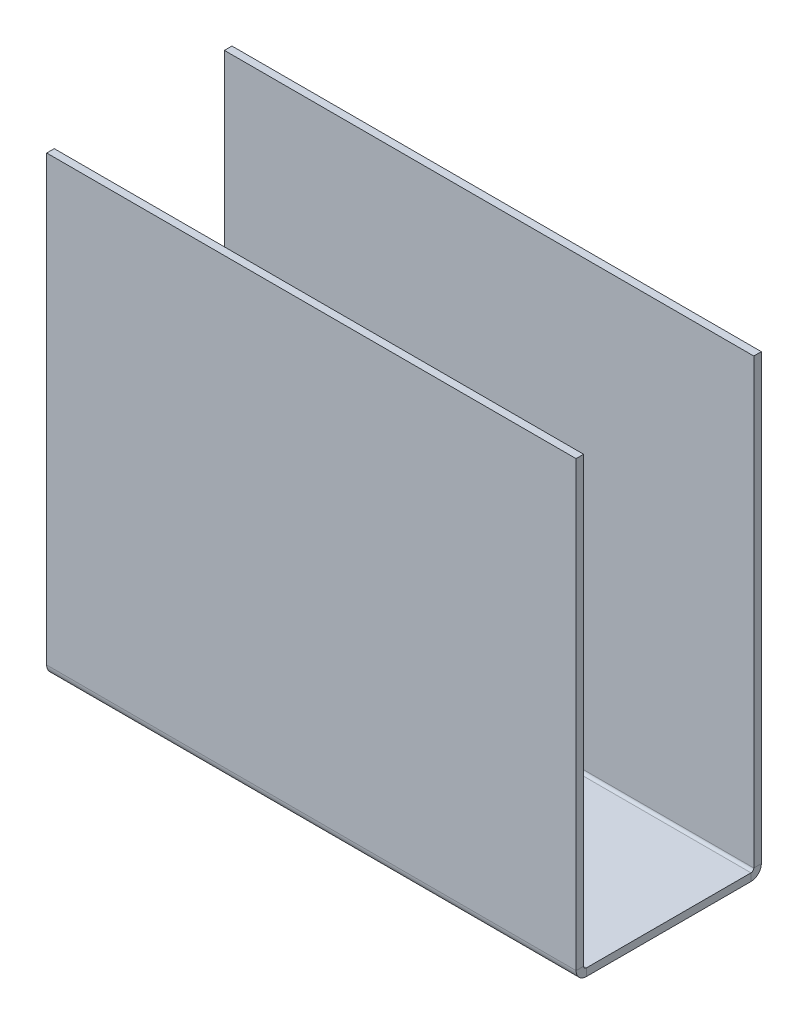
from build123d import *

# Parameters (mm, degrees)
SKETCH1_W                      = 140
SKETCH1_H                      = 49
BASE_FLANGE1_DEPTH             = 2
EDGE_FLANGE1_STRIP_W           = 9.4732
EDGE_FLANGE1_STRIP_H           = 2
EDGE_FLANGE1_STRIP_CUT_DEPTH   = 140
EDGE_FLANGE1_STRIP_2_W         = 9.4732
EDGE_FLANGE1_STRIP_2_H         = 2
EDGE_FLANGE1_STRIP_CUT_2_DEPTH = 140
EDGE_FLANGE1_DEPTH             = 140
EDGE_FLANGE1_BEND_DEPTH        = 140


# Sheet-metal steps are written as plain solids
with BuildPart() as part:
    # Sketch1 → Base-Flange1 (new body)
    with BuildSketch(Plane(origin=(0, 0, 0), x_dir=(1, 0, 0), z_dir=(0, 1, 0))):
        with Locations((-43.384892086, -11.721223022)):
            Rectangle(SKETCH1_W, SKETCH1_H)
    extrude(amount=-BASE_FLANGE1_DEPTH)

    # Edge-Flange1 strip (across the edge) → Edge-Flange1 strip cut (cut)
    with BuildSketch(Plane(origin=(26.615107914, 0, -12.778776978), x_dir=(0, 0, 1), z_dir=(-1, 0, 0))):
        with Locations((-2, -1)):
            Rectangle(EDGE_FLANGE1_STRIP_W, EDGE_FLANGE1_STRIP_H)
    extrude(amount=EDGE_FLANGE1_STRIP_CUT_DEPTH, mode=Mode.SUBTRACT)

    # Edge-Flange1 strip 2 (across the edge) → Edge-Flange1 strip cut 2 (cut)
    with BuildSketch(Plane(origin=(-113.384892086, 0, 36.221223022), x_dir=(0, 0, -1), z_dir=(1, 0, 0))):
        with Locations((-2, -1)):
            Rectangle(EDGE_FLANGE1_STRIP_2_W, EDGE_FLANGE1_STRIP_2_H)
    extrude(amount=EDGE_FLANGE1_STRIP_CUT_2_DEPTH, mode=Mode.SUBTRACT)

    # Edge-Flange1 section (across the edge) → Edge-Flange1 (add)
    with BuildSketch(Plane(origin=(26.615107914, 0, -12.778776978), x_dir=(0, 0, 1), z_dir=(-1, 0, 0))):
        with BuildLine():
            Line((0, 0.7366), (0, 118))
            Line((0, 118), (2, 118))
            Line((2, 118), (2, 0.7366))
            ThreePointArc((2, 0.7366), (2.215745145, 0.215745145), (2.7366, 0))
            Line((2.7366, 0), (2.7366, -2))
            ThreePointArc((2.7366, -2), (0.801531583, -1.198468417), (0, 0.7366))
        make_face()
    extrude(amount=EDGE_FLANGE1_DEPTH)

    # Edge-Flange1 section 2 (across the edge) → Edge-Flange1 bend (add)
    with BuildSketch(Plane(origin=(-113.384892086, 0, 36.221223022), x_dir=(0, 0, -1), z_dir=(1, 0, 0))):
        with BuildLine():
            Line((0, 0.7366), (0, 118))
            Line((0, 118), (2, 118))
            Line((2, 118), (2, 0.7366))
            ThreePointArc((2, 0.7366), (2.215745145, 0.215745145), (2.7366, 0))
            Line((2.7366, 0), (2.7366, -2))
            ThreePointArc((2.7366, -2), (0.801531583, -1.198468417), (0, 0.7366))
        make_face()
    extrude(amount=EDGE_FLANGE1_BEND_DEPTH)


solid = part.part
